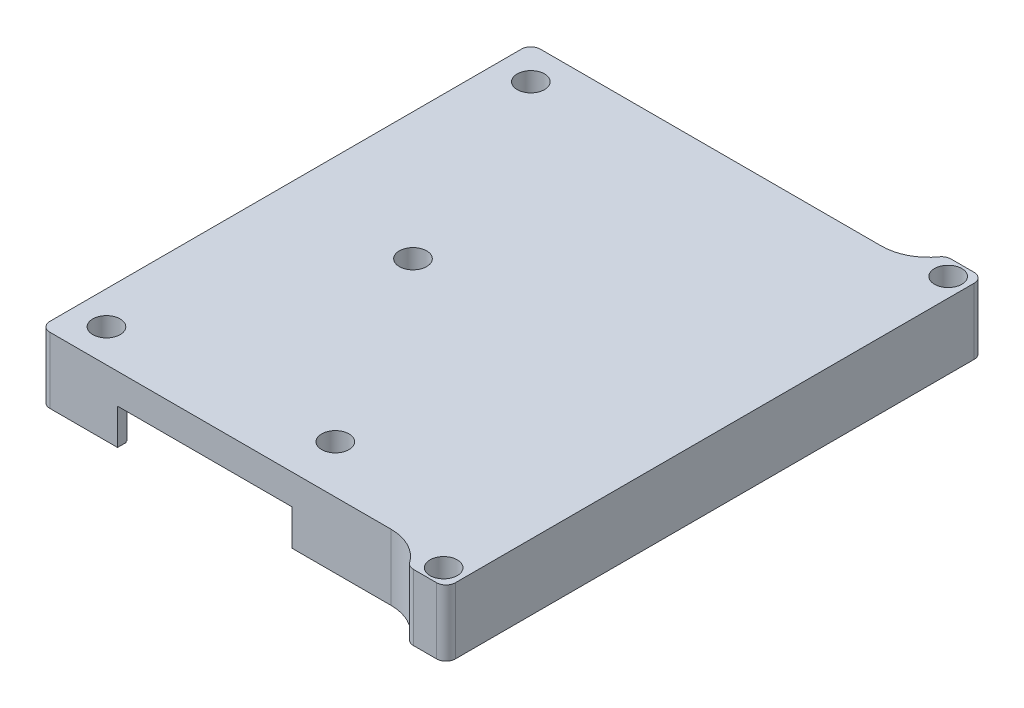
from build123d import *

# Parameters (mm, degrees)
SKETCH1_W           = 91
SKETCH1_H           = 104
SKETCH1_W_2         = 87
SKETCH1_H_2         = 100
BOSS_EXTRUDE1_DEPTH = 12
SKETCH2_W           = 91
SKETCH2_H           = 104
BOSS_EXTRUDE2_DEPTH = 2
SKETCH3_R           = 3.5
BOSS_EXTRUDE3_DEPTH = 12
SKETCH6_W           = 8
SKETCH6_H           = 5
BOSS_EXTRUDE4_DEPTH = 14
CUT_EXTRUDE1_REACH  = 141.879
SKETCH4_R           = 1.5
SKETCH7_R           = 2.9
CUT_EXTRUDE2_DEPTH  = 8
SKETCH8_W           = 33
SKETCH8_H           = 2
CUT_EXTRUDE3_DEPTH  = 1.3
SKETCH9_W           = 87.4
SKETCH9_H           = 100.4
SKETCH9_W_2         = 87
SKETCH9_H_2         = 100
CUT_EXTRUDE4_DEPTH  = 0.2
SKETCH10_W          = 6
SKETCH10_H          = 10
BOSS_EXTRUDE7_DEPTH = 5
CUT_EXTRUDE5_REACH  = 143.23
SKETCH11_R          = 0.75
SKETCH12_W          = 37
SKETCH12_H          = 7.6
CUT_EXTRUDE6_DEPTH  = 7
CUT_EXTRUDE7_REACH  = 142.975
SKETCH13_W          = 72
SKETCH13_H          = 7.6
FILLET1_R           = 10
FILLET2_R           = 2
SKETCH14_W          = 10
SKETCH14_H          = 4
CUT_EXTRUDE8_DEPTH  = 0.5


with BuildPart() as part:
    # Sketch1 → Boss-Extrude1 (new body)
    with BuildSketch(Plane(origin=(0, 0, 0), x_dir=(1, 0, 0), z_dir=(0, 1, 0))):
        with Locations((43.5, 50)):
            Rectangle(SKETCH1_W, SKETCH1_H)
        with Locations((43.5, 50)):
            Rectangle(SKETCH1_W_2, SKETCH1_H_2, mode=Mode.SUBTRACT)
    extrude(amount=-BOSS_EXTRUDE1_DEPTH)

    # Sketch2 → Boss-Extrude2 (add)
    with BuildSketch(Plane(origin=(0, 0, 0), x_dir=(1, 0, 0), z_dir=(0, 1, 0))):
        with Locations((43.5, 50)):
            Rectangle(SKETCH2_W, SKETCH2_H)
    extrude(amount=BOSS_EXTRUDE2_DEPTH)

    # Sketch3 → Boss-Extrude3 (add)
    with BuildSketch(Plane.XZ):
        with Locations(Location((5, -5, 0), (0, 0, 90))):
            Circle(SKETCH3_R)
        with Locations(Location((5, -95, 0), (0, 0, 90))):
            Circle(SKETCH3_R)
        with Locations(Location((50.38, -8.15, 0), (0, 0, 90))):
            Circle(SKETCH3_R)
        with Locations(Location((25, -50, 0), (0, 0, 90))):
            Circle(SKETCH3_R)
    extrude(amount=BOSS_EXTRUDE3_DEPTH)

    # Sketch6 → Boss-Extrude4 (add, through all)
    with BuildSketch(Plane(origin=(0, 2, 0), x_dir=(1, 0, 0), z_dir=(0, 1, 0))):
        with Locations((85, 104.5)):
            Rectangle(SKETCH6_W, SKETCH6_H)
        with Locations((85, -4.5)):
            Rectangle(SKETCH6_W, SKETCH6_H)
    extrude(amount=-BOSS_EXTRUDE4_DEPTH)

    # Sketch4 → Cut-Extrude1 (cut, up to next)
    with BuildSketch(Plane(origin=(0, 2, 0), x_dir=(1, 0, 0), z_dir=(0, 1, 0)), mode=Mode.PRIVATE) as cut_extrude1_sk1:
        with Locations(Location((5, 5, 0), (0, 0, 270))):
            Circle(SKETCH4_R)
    cut_extrude1_tool1 = extrude(cut_extrude1_sk1.sketch, amount=-CUT_EXTRUDE1_REACH, mode=Mode.PRIVATE) & part.part
    # Sketch4 → Cut-Extrude1 (cut, up to next)
    with BuildSketch(Plane(origin=(0, 2, 0), x_dir=(1, 0, 0), z_dir=(0, 1, 0)), mode=Mode.PRIVATE) as cut_extrude1_sk2:
        with Locations(Location((5, 95, 0), (0, 0, 270))):
            Circle(SKETCH4_R)
    cut_extrude1_tool2 = extrude(cut_extrude1_sk2.sketch, amount=-CUT_EXTRUDE1_REACH, mode=Mode.PRIVATE) & part.part
    # Sketch4 → Cut-Extrude1 (cut, up to next)
    with BuildSketch(Plane(origin=(0, 2, 0), x_dir=(1, 0, 0), z_dir=(0, 1, 0)), mode=Mode.PRIVATE) as cut_extrude1_sk3:
        with Locations(Location((50.38, 8.15, 0), (0, 0, 270))):
            Circle(SKETCH4_R)
    cut_extrude1_tool3 = extrude(cut_extrude1_sk3.sketch, amount=-CUT_EXTRUDE1_REACH, mode=Mode.PRIVATE) & part.part
    # Sketch4 → Cut-Extrude1 (cut, up to next)
    with BuildSketch(Plane(origin=(0, 2, 0), x_dir=(1, 0, 0), z_dir=(0, 1, 0)), mode=Mode.PRIVATE) as cut_extrude1_sk4:
        with Locations(Location((25, 50, 0), (0, 0, 270))):
            Circle(SKETCH4_R)
    cut_extrude1_tool4 = extrude(cut_extrude1_sk4.sketch, amount=-CUT_EXTRUDE1_REACH, mode=Mode.PRIVATE) & part.part
    # Sketch4 → Cut-Extrude1 (cut, up to next)
    with BuildSketch(Plane(origin=(0, 2, 0), x_dir=(1, 0, 0), z_dir=(0, 1, 0)), mode=Mode.PRIVATE) as cut_extrude1_sk5:
        with Locations(Location((85, 103.5, 0), (0, 0, 270))):
            Circle(SKETCH4_R)
    cut_extrude1_tool5 = extrude(cut_extrude1_sk5.sketch, amount=-CUT_EXTRUDE1_REACH, mode=Mode.PRIVATE) & part.part
    # Sketch4 → Cut-Extrude1 (cut, up to next)
    with BuildSketch(Plane(origin=(0, 2, 0), x_dir=(1, 0, 0), z_dir=(0, 1, 0)), mode=Mode.PRIVATE) as cut_extrude1_sk6:
        with Locations(Location((85, -3.5, 0), (0, 0, 270))):
            Circle(SKETCH4_R)
    cut_extrude1_tool6 = extrude(cut_extrude1_sk6.sketch, amount=-CUT_EXTRUDE1_REACH, mode=Mode.PRIVATE) & part.part
    add(cut_extrude1_tool1.solids().sort_by_distance((5, 2, -5))[0], mode=Mode.SUBTRACT)
    add(cut_extrude1_tool2.solids().sort_by_distance((5, 2, -95))[0], mode=Mode.SUBTRACT)
    add(cut_extrude1_tool3.solids().sort_by_distance((50.38, 2, -8.15))[0], mode=Mode.SUBTRACT)
    add(cut_extrude1_tool4.solids().sort_by_distance((25, 2, -50))[0], mode=Mode.SUBTRACT)
    add(cut_extrude1_tool5.solids().sort_by_distance((85, 2, -103.5))[0], mode=Mode.SUBTRACT)
    add(cut_extrude1_tool6.solids().sort_by_distance((85, 2, 3.5))[0], mode=Mode.SUBTRACT)

    # Sketch7 → Cut-Extrude2 (cut)
    with BuildSketch(Plane(origin=(0, 2, 0), x_dir=(1, 0, 0), z_dir=(0, 1, 0))):
        with Locations(Location((5, 5, 0), (0, 0, 270))):
            Circle(SKETCH7_R)
        with Locations(Location((25, 50, 0), (0, 0, 270))):
            Circle(SKETCH7_R)
        with Locations(Location((50.38, 8.15, 0), (0, 0, 270))):
            Circle(SKETCH7_R)
        with Locations(Location((5, 95, 0), (0, 0, 270))):
            Circle(SKETCH7_R)
        with Locations(Location((85, 103.5, 0), (0, 0, 270))):
            Circle(SKETCH7_R)
        with Locations(Location((85, -3.5, 0), (0, 0, 270))):
            Circle(SKETCH7_R)
    extrude(amount=-CUT_EXTRUDE2_DEPTH, mode=Mode.SUBTRACT)

    # Sketch8 → Cut-Extrude3 (cut)
    with BuildSketch(Plane.XY.offset(-100)):
        with Locations((66.5, -11)):
            Rectangle(SKETCH8_W, SKETCH8_H)
    extrude(amount=-CUT_EXTRUDE3_DEPTH, mode=Mode.SUBTRACT)

    # Sketch9 → Cut-Extrude4 (cut)
    with BuildSketch(Plane(origin=(0, -12, 0), x_dir=(-1, 0, 0), z_dir=(0, -1, 0))):
        with Locations((-43.5, 50)):
            Rectangle(SKETCH9_W, SKETCH9_H)
        with Locations((-43.5, 50)):
            Rectangle(SKETCH9_W_2, SKETCH9_H_2, mode=Mode.SUBTRACT)
    extrude(amount=-CUT_EXTRUDE4_DEPTH, mode=Mode.SUBTRACT)

    # Sketch10 → Boss-Extrude7 (add)
    with BuildSketch(Plane.XY.offset(-100)):
        with Locations((53, -5)):
            Rectangle(SKETCH10_W, SKETCH10_H)
        with Locations((80, -5)):
            Rectangle(SKETCH10_W, SKETCH10_H)
    extrude(amount=BOSS_EXTRUDE7_DEPTH)

    # Sketch11 → Cut-Extrude5 (cut, up to next)
    with BuildSketch(Plane(origin=(0, 0, -102), x_dir=(-1, 0, 0), z_dir=(0, 0, -1)), mode=Mode.PRIVATE) as cut_extrude5_sk1:
        with Locations((-43.257, -10.5)):
            Circle(SKETCH11_R)
    cut_extrude5_tool1 = extrude(cut_extrude5_sk1.sketch, amount=-CUT_EXTRUDE5_REACH, mode=Mode.PRIVATE) & part.part
    # Sketch11 → Cut-Extrude5 (cut, up to next)
    with BuildSketch(Plane(origin=(0, 0, -102), x_dir=(-1, 0, 0), z_dir=(0, 0, -1)), mode=Mode.PRIVATE) as cut_extrude5_sk2:
        with BuildLine():
            Line((-41.957, -12), (-31.457, -12))
            Line((-31.457, -12), (-31.457, -9))
            ThreePointArc((-31.457, -9), (-31.749893219, -8.292893219), (-32.457, -8))
            Line((-32.457, -8), (-40.957, -8))
            ThreePointArc((-40.957, -8), (-41.664106781, -8.292893219), (-41.957, -9))
            Line((-41.957, -9), (-41.957, -12))
        make_face()
    cut_extrude5_tool2 = extrude(cut_extrude5_sk2.sketch, amount=-CUT_EXTRUDE5_REACH, mode=Mode.PRIVATE) & part.part
    add(cut_extrude5_tool1.solids().sort_by_distance((43.257, -10.5, -102))[0], mode=Mode.SUBTRACT)
    add(cut_extrude5_tool2.solids().sort_by_distance((36.707, -10.018343, -102))[0], mode=Mode.SUBTRACT)

    # Sketch12 → Cut-Extrude6 (cut)
    with BuildSketch(Plane.XY.offset(2)):
        with Locations((32.85, -8.2)):
            Rectangle(SKETCH12_W, SKETCH12_H)
    extrude(amount=-CUT_EXTRUDE6_DEPTH, mode=Mode.SUBTRACT)

    # Sketch13 → Cut-Extrude7 (cut, up to next)
    with BuildSketch(Plane.ZY.offset(2), mode=Mode.PRIVATE) as cut_extrude7_sk1:
        with Locations((-50, -8.2)):
            Rectangle(SKETCH13_W, SKETCH13_H)
    cut_extrude7_tool1 = extrude(cut_extrude7_sk1.sketch, amount=-CUT_EXTRUDE7_REACH, mode=Mode.PRIVATE) & part.part
    add(cut_extrude7_tool1.solids().sort_by_distance((-2, -8.2, -50))[0], mode=Mode.SUBTRACT)

    # Fillet1
    # the kernel refuses this fillet: 10 mm, written as the material it adds along each edge
    with BuildSketch(Plane(origin=(81, 2, -102), x_dir=(0, 0, -1), z_dir=(0, -1, 0))) as fillet1_piece_1:
        with BuildLine():
            CenterArc((10, -8.660254038), FILLET1_R, 120, 60)
            Line((0, -8.660254038), (-0.2, -8.660254038))
            Line((-0.2, -8.660254038), (-0.2, 0))
            Line((-0.2, 0), (0, 0.2))
            ThreePointArc((0, 0.2), (2.5, 0.2), (4.9, 0.173205081))
            Line((4.9, 0.173205081), (5, 0))
        make_face()
    extrude(amount=14)
    with BuildSketch(Plane(origin=(81, 2, 2), x_dir=(-1, 0, 0), z_dir=(0, -1, 0))) as fillet1_piece_2:
        with BuildLine():
            CenterArc((8.660254038, -10), FILLET1_R, 90, 60)
            Line((0, -5), (-0.173205081, -4.9))
            ThreePointArc((-0.173205081, -4.9), (-0.2, -2.5), (-0.2, 0))
            Line((-0.2, 0), (0, 0.2))
            Line((0, 0.2), (8.660254038, 0.2))
            Line((8.660254038, 0.2), (8.660254038, 0))
        make_face()
    extrude(amount=14)

    # Fillet2
    fillet2_edges = [part.edges().sort_by_distance(p)[0] for p in [
        (81, -5, -107),
        (89, -5, -107),
        (89, -5, 7),
        (81, -5, 7),
        (-2, -5, 2),
        (-2, -5, -102),
    ]]
    fillet(fillet2_edges, radius=FILLET2_R)

    # Sketch14 → Cut-Extrude8 (cut)
    with BuildSketch(Plane.XY.offset(-100)):
        with Locations((21.757, -10)):
            Rectangle(SKETCH14_W, SKETCH14_H)
    extrude(amount=-CUT_EXTRUDE8_DEPTH, mode=Mode.SUBTRACT)


solid = part.part
